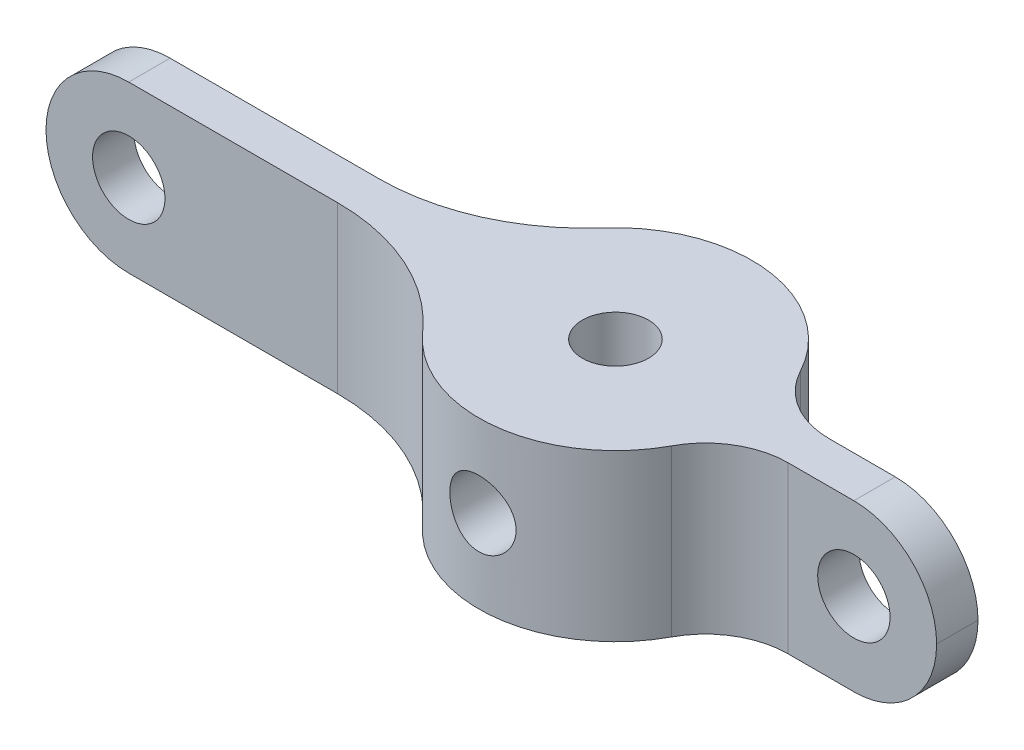
from build123d import *

# Parameters (mm, degrees)
SKETCH1_R               = 1.6
BOSS_EXTRUDE1_DEPTH     = 8
CUT_EXTRUDE1_DEPTH      = 29.727549545
CUT_EXTRUDE1_DEPTH_BACK = 29.727549545
SKETCH2_R               = 1.75
SKETCH2_R_2             = 1.6
FILLET1_R               = 10
FILLET2_R               = 4
FILLET3_R               = 4


with BuildPart() as part:
    # Sketch1 → Boss-Extrude1 (new body)
    with BuildSketch(Plane(origin=(0, 0, 0), x_dir=(1, 0, 0), z_dir=(0, 1, 0))):
        with BuildLine():
            Line((-26.523802572, 1), (-6.523802572, 1))
            ThreePointArc((-6.523802572, 1), (0, 6.6), (6.523802572, 1))
            Line((6.523802572, 1), (16.523802572, 1))
            Line((16.523802572, 1), (16.523802572, -1))
            Line((16.523802572, -1), (6.523802572, -1))
            ThreePointArc((6.523802572, -1), (0, -6.6), (-6.523802572, -1))
            Line((-6.523802572, -1), (-26.523802572, -1))
            Line((-26.523802572, -1), (-26.523802572, 1))
        make_face()
        with Locations(Location((0, 0, 0), (0, 0, 270))):
            Circle(SKETCH1_R, mode=Mode.SUBTRACT)
    extrude(amount=BOSS_EXTRUDE1_DEPTH)

    # Sketch2 → Cut-Extrude1 (cut, two sides: drawn at the far end of the back side and taken through both)
    with BuildSketch(Plane.XY.offset(1).offset(-CUT_EXTRUDE1_DEPTH_BACK)):
        with BuildLine():
            ThreePointArc((-26.523802572, 4.000000071), (-25.352229672, 6.82842715), (-22.523802572, 8))
            Line((-22.523802572, 8), (-26.523802572, 8))
            Line((-26.523802572, 8), (-26.523802572, 4.000000071))
        make_face()
        with BuildLine():
            Line((-26.523802572, 0), (-22.523802572, 0))
            ThreePointArc((-22.523802572, 0), (-25.352229722, 1.171572901), (-26.523802572, 4.000000071))
            Line((-26.523802572, 4.000000071), (-26.523802572, 0))
        make_face()
        with Locations(Location((-22.523802572, 4, 0), (0, 0, 180))):
            Circle(SKETCH2_R)
        with Locations((0, 4)):
            Circle(SKETCH2_R_2)
        with Locations(Location((12.523802572, 4, 0), (0, 0, 180))):
            Circle(SKETCH2_R)
    extrude(amount=CUT_EXTRUDE1_DEPTH + CUT_EXTRUDE1_DEPTH_BACK, mode=Mode.SUBTRACT)

    # Fillet1
    fillet1_edges = [part.edges().sort_by_distance(p)[0] for p in [
        (-6.523802572, 4, 1),
        (-6.523802572, 4, -1),
    ]]
    fillet(fillet1_edges, radius=FILLET1_R)

    # Fillet2
    fillet2_edges = [part.edges().sort_by_distance(p)[0] for p in [
        (16.523802572, 0, 0),
        (16.523802572, 8, 0),
    ]]
    fillet(fillet2_edges, radius=FILLET2_R - 0.0001)  # a hair under: the kernel refuses the full size

    # Fillet3
    fillet3_edges = [part.edges().sort_by_distance(p)[0] for p in [
        (6.523802572, 4, 1),
        (6.523802572, 4, -1),
    ]]
    fillet(fillet3_edges, radius=FILLET3_R)


solid = part.part
